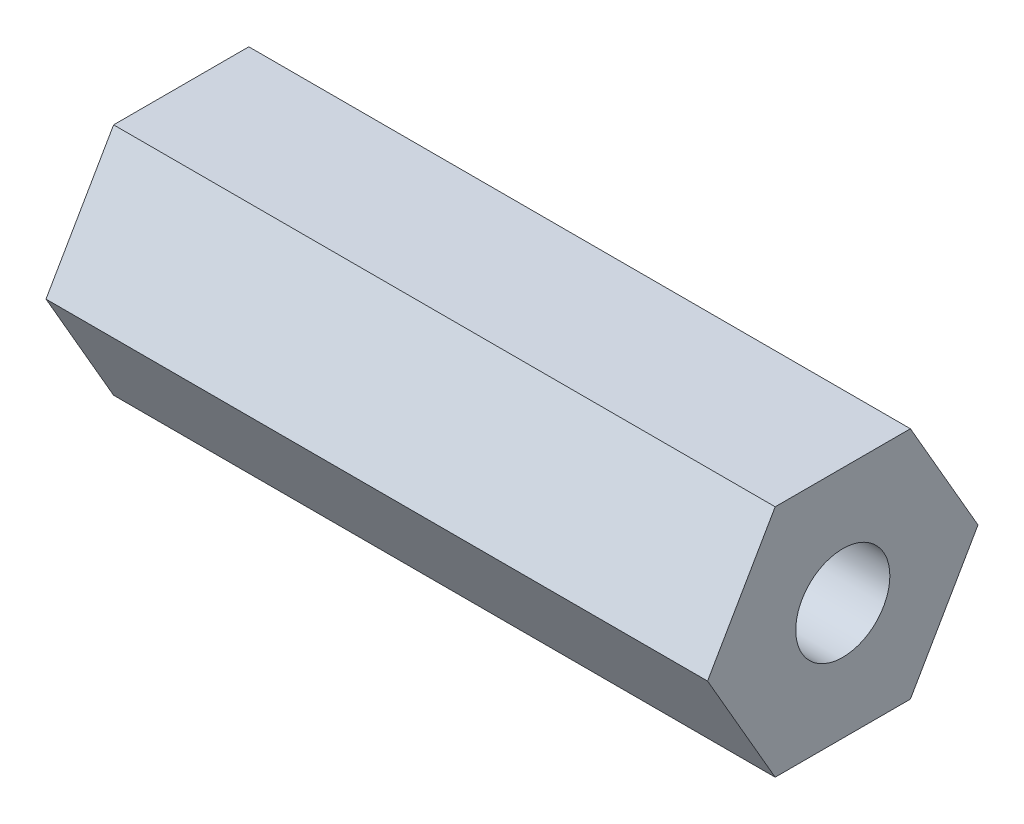
from build123d import *

# Parameters (mm, degrees)
BOSS_EXTRUDE1_DEPTH     = 17.9375
F_1_4_20_TAPPED_HOLE1_D = 5.1054


with BuildPart() as part:
    # Sketch1 → Boss-Extrude1 (new, symmetric)
    with BuildSketch(Plane(origin=(0, 0, 0), x_dir=(0, 0, -1), z_dir=(1, 0, 0))):
        Polygon((7.332348419, 0), (3.666174209, 6.35), (-3.666174209, 6.35), (-7.332348419, 0), (-3.666174209, -6.35), (3.666174209, -6.35), align=None)
    extrude(amount=BOSS_EXTRUDE1_DEPTH, both=True)

    # 1/4-20 Tapped Hole1 (through all)
    with Locations(Plane(origin=(17.9375, 0, 0), x_dir=(0, 0, -1), z_dir=(1, 0, 0))):
        with Locations((0, 0)):
            Hole(F_1_4_20_TAPPED_HOLE1_D / 2)


solid = part.part
